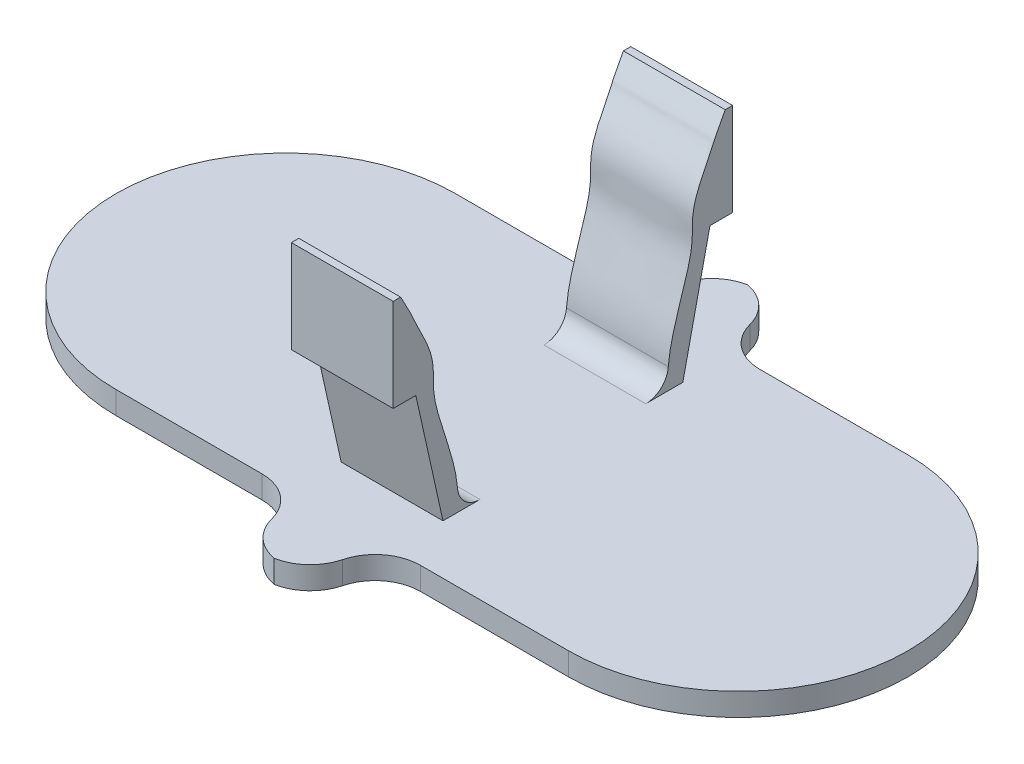
from build123d import *

# Parameters (mm, degrees)
BOSS_EXTRUDE1_DEPTH = 1.27
SKETCH2_W           = 5.715
SKETCH2_H           = 3.81
BOSS_EXTRUDE2_DEPTH = 12.065
CUT_EXTRUDE1_REACH  = 31.961
SKETCH5_W           = 3.81
SKETCH5_H           = 1.27
BOSS_EXTRUDE3_DEPTH = 3.81
FILLET1_R           = 1.27
FILLET2_R           = 2.54
FILLET3_R           = 2.54


with BuildPart() as part:
    # Sketch1 → Boss-Extrude1 (new body)
    with BuildSketch(Plane(origin=(0, 0, 0), x_dir=(1, 0, 0), z_dir=(0, 1, 0))):
        with BuildLine():
            Line((0, 9.525), (25.4, 9.525))
            ThreePointArc((25.4, 9.525), (34.925, 0), (25.4, -9.525))
            Line((25.4, -9.525), (0, -9.525))
            ThreePointArc((0, -9.525), (-9.525, 0), (0, 9.525))
        make_face()
    extrude(amount=BOSS_EXTRUDE1_DEPTH)

    # Sketch2 → Boss-Extrude2 (add)
    with BuildSketch(Plane(origin=(0, 1.27, 0), x_dir=(1, 0, 0), z_dir=(0, 1, 0))):
        with Locations((12.7, -7.62)):
            Rectangle(SKETCH2_W, SKETCH2_H)
    boss_extrude2 = extrude(amount=BOSS_EXTRUDE2_DEPTH)

    # Sketch3 → Cut-Extrude1 (cut, up to next)
    with BuildSketch(Plane.ZY.offset(-9.8425), mode=Mode.PRIVATE) as cut_extrude1_sk1:
        with BuildLine():
            Line((9.109202439, 13.335), (5.715, 13.335))
            Line((5.715, 13.335), (5.715, 1.27))
            Line((5.715, 1.27), (5.969, 1.27))
            add(Edge.make_bspline(
                [(5.969, 1.27), (5.549329098, 3.350430894), (7.78448223, 7.25064686), (7.073380845, 9.287510022), (8.952423462, 12.969109679), (8.055818696, 11.368012808), (9.109202439, 13.335)],
                knots=[0, 0, 0, 0, 0.483315661, 0.688146198, 0.724664182, 1, 1, 1, 1], degree=3))
        make_face()
    cut_extrude1_tool1 = extrude(cut_extrude1_sk1.sketch, amount=-CUT_EXTRUDE1_REACH, mode=Mode.PRIVATE) & part.part
    # Sketch3 → Cut-Extrude1 (cut, up to next)
    with BuildSketch(Plane.ZY.offset(-9.8425), mode=Mode.PRIVATE) as cut_extrude1_sk2:
        Polygon((9.525, 1.27), (9.525, 8.128), (8.255, 8.128), (6.731, 1.27), align=None)
    cut_extrude1_tool2 = extrude(cut_extrude1_sk2.sketch, amount=-CUT_EXTRUDE1_REACH, mode=Mode.PRIVATE) & part.part
    cut_extrude1_1 = cut_extrude1_tool1.solids().sort_by_distance((9.8425, 9.500256, 6.699344))[0]
    add(cut_extrude1_1, mode=Mode.SUBTRACT)
    cut_extrude1_2 = cut_extrude1_tool2.solids().sort_by_distance((9.8425, 4.270375, 8.461375))[0]
    add(cut_extrude1_2, mode=Mode.SUBTRACT)
    cut_extrude1 = cut_extrude1_1 + cut_extrude1_2  # Cut-Extrude1 as one shape, for the pattern or mirror that repeats it

    # Mirror1: Boss-Extrude2, Cut-Extrude1 across plane
    add(boss_extrude2.mirror(Plane.XY))
    add(cut_extrude1.mirror(Plane.XY), mode=Mode.SUBTRACT)

    # Sketch5 → Boss-Extrude3 (add)
    with BuildSketch(Plane.XY.offset(9.525)):
        with Locations((12.639699769, 0.635)):
            Rectangle(SKETCH5_W, SKETCH5_H)
    boss_extrude3 = extrude(amount=BOSS_EXTRUDE3_DEPTH)

    # Fillet1
    fillet1_edges = [part.edges().sort_by_distance(p)[0] for p in [
        (12.7, 1.27, 5.969),
        (12.7, 1.27, -5.969),
    ]]
    fillet(fillet1_edges, radius=FILLET1_R)

    # Mirror4: Boss-Extrude3 across plane
    add(boss_extrude3.mirror(Plane.XY))

    # Fillet2
    fillet2_edges = [part.edges().sort_by_distance(p)[0] for p in [
        (14.544699769, 0.635, -9.525),
        (10.734699769, 0.635, -9.525),
        (14.544699769, 0.635, 9.525),
        (10.734699769, 0.635, 9.525),
    ]]
    fillet(fillet2_edges, radius=FILLET2_R)

    # Fillet3
    # the kernel refuses this fillet: 2.54 mm, written as the material it takes off along each edge
    with BuildSketch(Plane(origin=(14.544699769, 7.216722124, 13.335), x_dir=(-1, 0, 0), z_dir=(0, -1, 0))) as fillet3_piece_1:
        with BuildLine():
            CenterArc((2.37868885, 2.54), FILLET3_R, 194.477512186, 75.522487814)
            Line((-0.080655575, 1.905), (-0.326590018, 1.8415))
            ThreePointArc((-0.326590018, 1.8415), (-0.254, 1.27), (-0.254, 0))
            Line((-0.254, 0), (0, -0.254))
            Line((0, -0.254), (2.37868885, -0.254))
            Line((2.37868885, -0.254), (2.37868885, 0))
        make_face()
    extrude(amount=13.163444248, mode=Mode.SUBTRACT)
    with BuildSketch(Plane(origin=(10.734699769, -5.946722124, 13.335), x_dir=(-0.04230098759681092, 0, -0.9991049126334703), z_dir=(0, 1, 0))) as fillet3_piece_2:
        with BuildLine():
            CenterArc((2.437105591, -2.484004224), FILLET3_R, 102.053120737, 75.522487814)
            Line((-0.100620888, -2.376559715), (-0.354393535, -2.365815264))
            Line((-0.354393535, -2.365815264), (-0.253772648, 0.010744451))
            Line((-0.253772648, 0.010744451), (0.010744451, 0.253772648))
            ThreePointArc((0.010744451, 0.253772648), (1.27960769, 0.200050394), (1.853666777, 0.248400422))
            Line((1.853666777, 0.248400422), (1.906706669, 0))
        make_face()
    extrude(amount=13.163444248, mode=Mode.SUBTRACT)
    with BuildSketch(Plane(origin=(14.544699769, 7.216722124, -13.335), x_dir=(-1, 0, 0), z_dir=(0, -1, 0))) as fillet3_piece_3:
        with BuildLine():
            CenterArc((2.37868885, -2.54), FILLET3_R, 90, 75.522487814)
            Line((-0.080655575, -1.905), (-0.326590018, -1.8415))
            ThreePointArc((-0.326590018, -1.8415), (-0.254, -1.27), (-0.254, 0))
            Line((-0.254, 0), (0, 0.254))
            Line((0, 0.254), (2.37868885, 0.254))
            Line((2.37868885, 0.254), (2.37868885, 0))
        make_face()
    extrude(amount=13.163444248, mode=Mode.SUBTRACT)
    with BuildSketch(Plane(origin=(10.734699769, -5.946722124, -13.335), x_dir=(-0.04230098759681092, 0, 0.9991049126334703), z_dir=(0, 1, 0))) as fillet3_piece_4:
        with BuildLine():
            CenterArc((2.437105591, 2.484004224), FILLET3_R, 182.424391449, 75.522487814)
            Line((-0.100620888, 2.376559715), (-0.354393535, 2.365815264))
            Line((-0.354393535, 2.365815264), (-0.253772648, -0.010744451))
            Line((-0.253772648, -0.010744451), (0.010744451, -0.253772648))
            ThreePointArc((0.010744451, -0.253772648), (1.27960769, -0.200050394), (1.853666777, -0.248400422))
            Line((1.853666777, -0.248400422), (1.906706669, 0))
        make_face()
    extrude(amount=13.163444248, mode=Mode.SUBTRACT)


solid = part.part
